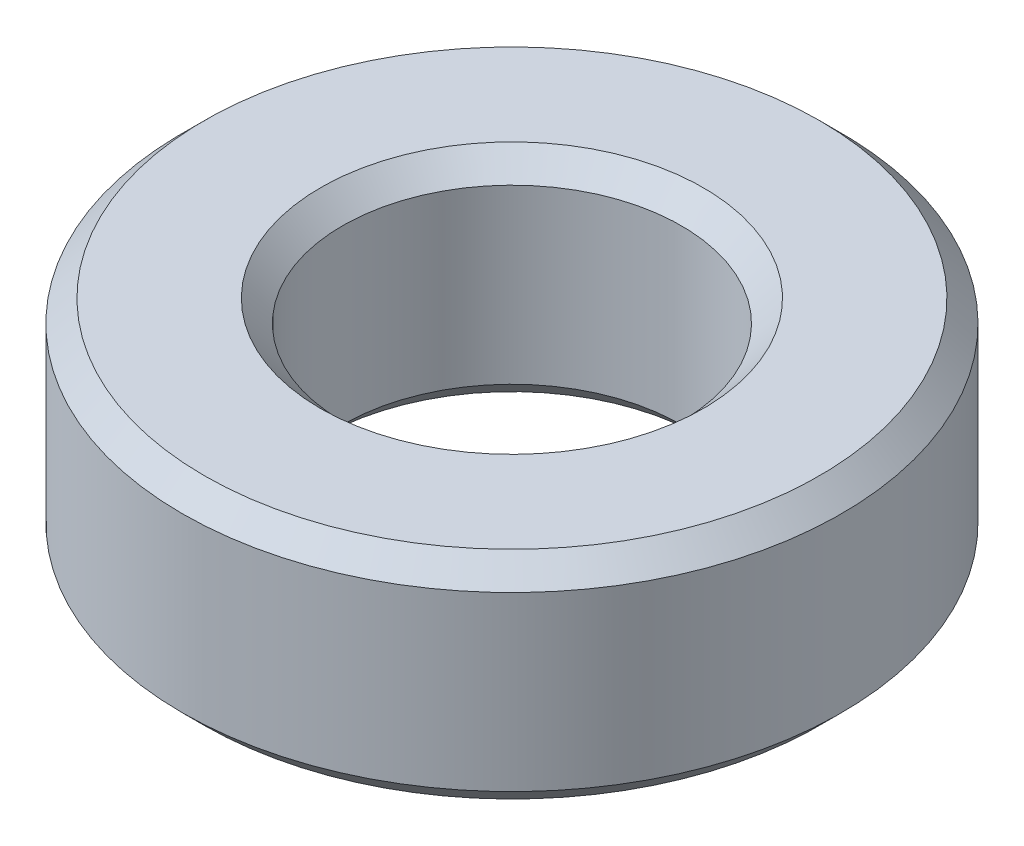
from build123d import *

# Parameters (mm, degrees)
SKETCH1_R           = 42.5
BOSS_EXTRUDE1_DEPTH = 27.893617841
SKETCH2_R           = 21.845052643
CUT_EXTRUDE1_DEPTH  = 67.261255016
CHAMFER1_SIZE       = 2.831587931


with BuildPart() as part:
    # Sketch1 → Boss-Extrude1 (new body)
    with BuildSketch(Plane(origin=(0, 0, 0), x_dir=(1, 0, 0), z_dir=(0, 1, 0))):
        Circle(SKETCH1_R)
    extrude(amount=BOSS_EXTRUDE1_DEPTH)

    # Sketch2 → Cut-Extrude1 (cut, through all)
    with BuildSketch(Plane(origin=(0, 0, 0), x_dir=(1, 0, 0), z_dir=(0, 1, 0))):
        Circle(SKETCH2_R)
    extrude(amount=CUT_EXTRUDE1_DEPTH, mode=Mode.SUBTRACT)

    # Chamfer1
    chamfer1_edges = [part.edges().sort_by_distance(p)[0] for p in [
        (-21.845052643, 27.893617841, 0),
        (-21.845052643, 0, 0),
        (-42.5, 0, 0),
        (-42.5, 27.893617841, 0),
    ]]
    chamfer(chamfer1_edges, length=CHAMFER1_SIZE)


solid = part.part
